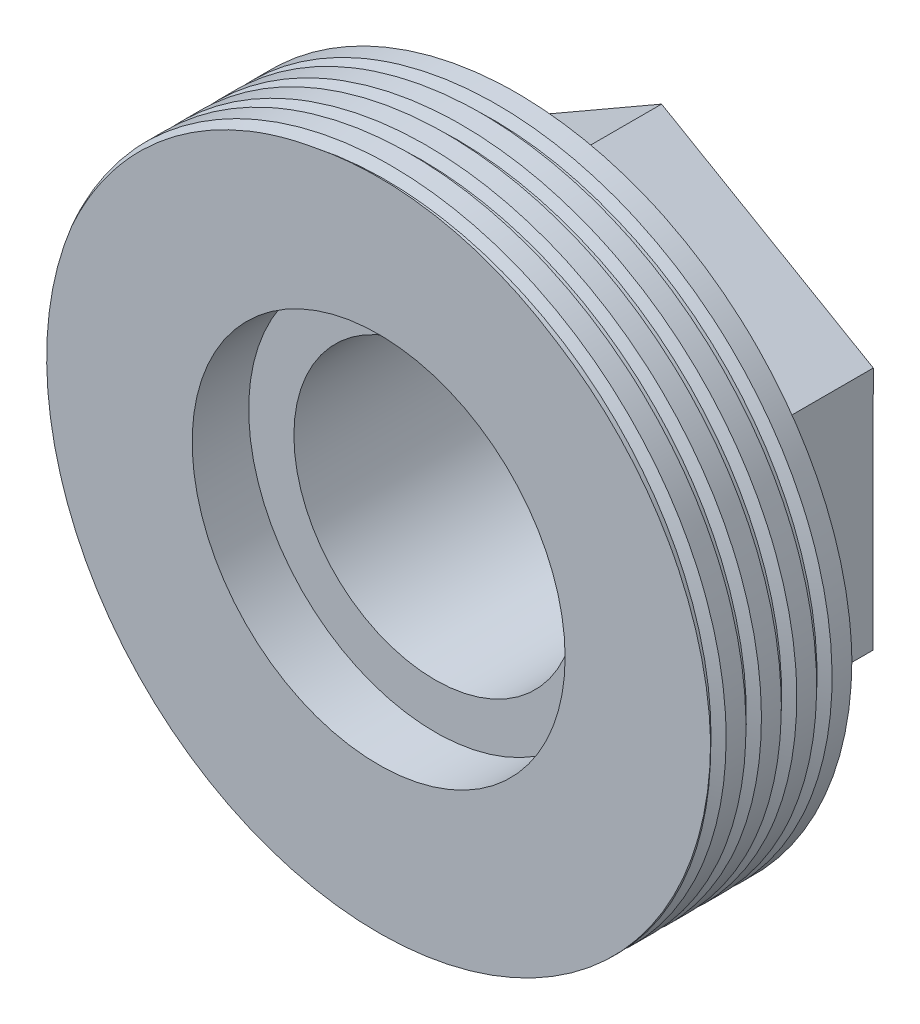
from build123d import *
from build123d.topology import SkipClean

# Parameters (mm, degrees)
SKETCH3_R           = 14.9225
BOSS_EXTRUDE1_DEPTH = 12.7
SKETCH11_R          = 6.35
CUT_EXTRUDE3_DEPTH  = 12.7
SKETCH12_R          = 8.382
CUT_EXTRUDE4_DEPTH  = 2.54
THREAD1_PITCH       = 1.5875
CUT_EXTRUDE6_START  = -6.35
SKETCH14_R          = 14.9225
CUT_EXTRUDE6_DEPTH  = 6.35


with BuildPart() as part:
    # Sketch3 → Boss-Extrude1 (new body)
    with BuildSketch(Plane.XY):
        with Locations((8.347593151, 27.723781851)):
            Circle(SKETCH3_R)
    extrude(amount=-BOSS_EXTRUDE1_DEPTH)

    # Sketch11 → Cut-Extrude3 (cut)
    with BuildSketch(Plane.XY):
        with Locations((8.347593151, 27.723781851)):
            Circle(SKETCH11_R)
    extrude(amount=-CUT_EXTRUDE3_DEPTH, mode=Mode.SUBTRACT)

    # Sketch12 → Cut-Extrude4 (cut)
    with BuildSketch(Plane.XY):
        with Locations((8.347593151, 27.723781851)):
            Circle(SKETCH12_R)
    extrude(amount=-CUT_EXTRUDE4_DEPTH, mode=Mode.SUBTRACT)

    # Thread1: the profile of Thread Profile1 profile screwed along a right-hand helix of 4.8 turns, 8 arcs to a turn; built about Z, then put on its axis
    thread1_z = Axis((0, 0, 0), (0, 0, 1))
    thread1_corners = [(14.9228, 0, -0.000173205), (14.9228, 0, 0.694704453), (14.492870212, 0, 0.446484374), (14.492870212, 0, 0.248046874)]
    with BuildLine(mode=Mode.PRIVATE) as thread1_profile:
        Line(thread1_corners[0], thread1_corners[1])
        Line(thread1_corners[1], thread1_corners[2])
        Line(thread1_corners[2], thread1_corners[3])
        Line(thread1_corners[3], thread1_corners[0])
    thread1_cap = Face(thread1_profile.wire())
    thread1_turn_angles = [0, 22.5, 45, 67.5, 90, 112.5, 135, 157.5, 180, 202.5, 225, 247.5, 270, 292.5, 315, 337.5, 360]
    thread1_turn_weights = [1, 0.9238795325112867, 1, 0.9238795325112867, 1, 0.9238795325112867, 1, 0.9238795325112867, 1, 0.9238795325112867, 1, 0.9238795325112867, 1, 0.9238795325112867, 1, 0.9238795325112867, 1]
    thread1_turn_rails = [Edge.make_bspline([Vector(p[0], p[1], 0).rotate(thread1_z, thread1_turn_angles[k]) / thread1_turn_weights[k] + Vector(0, 0, p[2] + THREAD1_PITCH * thread1_turn_angles[k] / 360) for k in range(17)], [0, 0, 0, 1, 1, 2, 2, 3, 3, 4, 4, 5, 5, 6, 6, 7, 7, 8, 8, 8], 2, thread1_turn_weights) for p in thread1_corners]
    thread1_turn_sides = [Face.make_surface_from_curves(thread1_turn_rails[p[0]], thread1_turn_rails[p[1]]) for p in [(0, 1), (1, 2), (2, 3), (3, 0)]]
    thread1_last_angles = [1440, 1462.5, 1485, 1507.5, 1530, 1552.5, 1575, 1597.5, 1620, 1642.5, 1665, 1687.5, 1710, 1719, 1728]
    thread1_last_weights = [1, 0.9238795325112867, 1, 0.9238795325112867, 1, 0.9238795325112867, 1, 0.9238795325112867, 1, 0.9238795325112867, 1, 0.9238795325112867, 1, 0.9876883405951378, 1]
    thread1_last_rails = [Edge.make_bspline([Vector(p[0], p[1], 0).rotate(thread1_z, thread1_last_angles[k]) / thread1_last_weights[k] + Vector(0, 0, p[2] + THREAD1_PITCH * thread1_last_angles[k] / 360) for k in range(15)], [0, 0, 0, 1, 1, 2, 2, 3, 3, 4, 4, 5, 5, 6, 6, 7, 7, 7], 2, thread1_last_weights) for p in thread1_corners]
    thread1_last_sides = [Face.make_surface_from_curves(thread1_last_rails[p[0]], thread1_last_rails[p[1]]) for p in [(0, 1), (1, 2), (2, 3), (3, 0)]]
    thread1 = Plane(origin=(8.347593151, 27.723781851, 0.79375), x_dir=(-1, 0, 0), z_dir=(0, 0, -1)) * Solid(Shell([*[p.moved(Location((0, 0, THREAD1_PITCH * i))) for i in range(4) for p in thread1_turn_sides], *thread1_last_sides, thread1_cap, thread1_cap.rotate(thread1_z, 1728).moved(Location((0, 0, THREAD1_PITCH * 1728 / 360)))]))
    add(thread1, mode=Mode.SUBTRACT)

    # Sketch14 → Cut-Extrude6 (cut)
    with SkipClean():  # the faces are left unmerged after this step: merging them gives an invalid solid
        with BuildSketch(Plane(origin=(0, 0, -12.7), x_dir=(-1, 0, 0), z_dir=(0, 0, -1)).offset(CUT_EXTRUDE6_START)):
            with Locations((-8.347593151, 27.723781851)):
                Circle(SKETCH14_R)
            Polygon((1.186658464, 22.240576024), (1.168128197, 33.239083042), (-8.366123418, 38.722288869), (-17.881844766, 33.206987678), (-17.863314499, 22.20848066), (-8.329062884, 16.725274833), align=None, mode=Mode.SUBTRACT)
        extrude(amount=CUT_EXTRUDE6_DEPTH, mode=Mode.SUBTRACT)
    add(part.part.scale(1), mode=Mode.REPLACE)  # the faces are merged on a copy


solid = part.part
